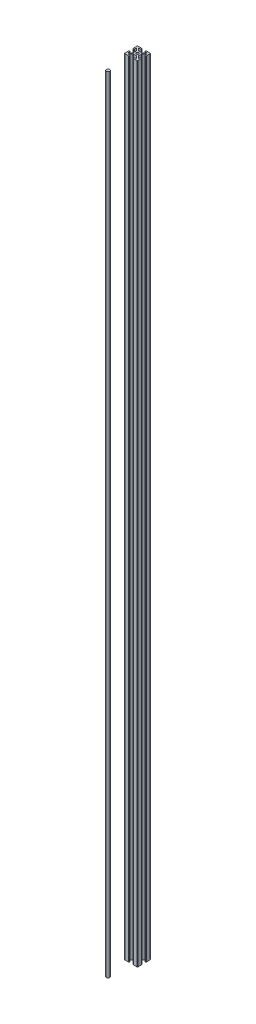
from build123d import *

# Parameters (mm, degrees)
ALUMINIUM_PROFILE_SIZES_4X4_1_OUTLINE_R = 2
ALUMINIUM_PROFILE_SIZES_4X4_1_DEPTH     = 1200
SKETCH12_R                              = 2.5
BOSS_EXTRUDE1_DEPTH                     = 1200
SKETCH13_R                              = 2.5
CUT_EXTRUDE1_DEPTH                      = 1202.021336197


# Read off the part's stored shape, not the designer's step: Aluminium profile sizes 4X4(1)
with BuildPart() as part:
    # Aluminium profile sizes 4X4(1) outline → Aluminium profile sizes 4X4(1) (new body)
    with BuildSketch(Plane(origin=(0, 0, 0), x_dir=(1, 0, 0), z_dir=(0, 1, 0))):
        with BuildLine():
            Line((4, -2.254415588), (4, 2.254415588))
            ThreePointArc((4, 2.254415588), (4.060896374, 2.560562334), (4.234314575, 2.820101013))
            Line((4.234314575, 2.820101013), (8, 6.585786438))
            Line((8, 6.585786438), (8, 3.8))
            ThreePointArc((8, 3.8), (8.234314575, 3.234314575), (8.8, 3))
            Line((8.8, 3), (9.2, 3))
            ThreePointArc((9.2, 3), (9.765685425, 3.234314575), (10, 3.8))
            Line((10, 3.8), (10, 9.2))
            ThreePointArc((10, 9.2), (9.765685425, 9.765685425), (9.2, 10))
            Line((9.2, 10), (3.8, 10))
            ThreePointArc((3.8, 10), (3.234314575, 9.765685425), (3, 9.2))
            Line((3, 9.2), (3, 8.8))
            ThreePointArc((3, 8.8), (3.234314575, 8.234314575), (3.8, 8))
            Line((3.8, 8), (6.585786438, 8))
            Line((6.585786438, 8), (2.820101013, 4.234314575))
            ThreePointArc((2.820101013, 4.234314575), (2.560562334, 4.060896374), (2.254415588, 4))
            Line((2.254415588, 4), (-2.254415588, 4))
            ThreePointArc((-2.254415588, 4), (-2.560562334, 4.060896374), (-2.820101013, 4.234314575))
            Line((-2.820101013, 4.234314575), (-6.585786438, 8))
            Line((-6.585786438, 8), (-3.8, 8))
            ThreePointArc((-3.8, 8), (-3.234314575, 8.234314575), (-3, 8.8))
            Line((-3, 8.8), (-3, 9.2))
            ThreePointArc((-3, 9.2), (-3.234314575, 9.765685425), (-3.8, 10))
            Line((-3.8, 10), (-9.2, 10))
            ThreePointArc((-9.2, 10), (-9.765685425, 9.765685425), (-10, 9.2))
            Line((-10, 9.2), (-10, 3.8))
            ThreePointArc((-10, 3.8), (-9.765685425, 3.234314575), (-9.2, 3))
            Line((-9.2, 3), (-8.8, 3))
            ThreePointArc((-8.8, 3), (-8.234314575, 3.234314575), (-8, 3.8))
            Line((-8, 3.8), (-8, 6.585786438))
            Line((-8, 6.585786438), (-4.234314575, 2.820101013))
            ThreePointArc((-4.234314575, 2.820101013), (-4.060896374, 2.560562334), (-4, 2.254415588))
            Line((-4, 2.254415588), (-4, -2.254415588))
            ThreePointArc((-4, -2.254415588), (-4.060896374, -2.560562334), (-4.234314575, -2.820101013))
            Line((-4.234314575, -2.820101013), (-8, -6.585786438))
            Line((-8, -6.585786438), (-8, -3.8))
            ThreePointArc((-8, -3.8), (-8.234314575, -3.234314575), (-8.8, -3))
            Line((-8.8, -3), (-9.2, -3))
            ThreePointArc((-9.2, -3), (-9.765685425, -3.234314575), (-10, -3.8))
            Line((-10, -3.8), (-10, -9.2))
            ThreePointArc((-10, -9.2), (-9.765685425, -9.765685425), (-9.2, -10))
            Line((-9.2, -10), (-3.8, -10))
            ThreePointArc((-3.8, -10), (-3.234314575, -9.765685425), (-3, -9.2))
            Line((-3, -9.2), (-3, -8.8))
            ThreePointArc((-3, -8.8), (-3.234314575, -8.234314575), (-3.8, -8))
            Line((-3.8, -8), (-6.585786438, -8))
            Line((-6.585786438, -8), (-2.820101013, -4.234314575))
            ThreePointArc((-2.820101013, -4.234314575), (-2.560562334, -4.060896374), (-2.254415588, -4))
            Line((-2.254415588, -4), (2.254415588, -4))
            ThreePointArc((2.254415588, -4), (2.560562334, -4.060896374), (2.820101013, -4.234314575))
            Line((2.820101013, -4.234314575), (6.585786438, -8))
            Line((6.585786438, -8), (3.8, -8))
            ThreePointArc((3.8, -8), (3.234314575, -8.234314575), (3, -8.8))
            Line((3, -8.8), (3, -9.2))
            ThreePointArc((3, -9.2), (3.234314575, -9.765685425), (3.8, -10))
            Line((3.8, -10), (9.2, -10))
            ThreePointArc((9.2, -10), (9.765685425, -9.765685425), (10, -9.2))
            Line((10, -9.2), (10, -3.8))
            ThreePointArc((10, -3.8), (9.765685425, -3.234314575), (9.2, -3))
            Line((9.2, -3), (8.8, -3))
            ThreePointArc((8.8, -3), (8.234314575, -3.234314575), (8, -3.8))
            Line((8, -3.8), (8, -6.585786438))
            Line((8, -6.585786438), (4.234314575, -2.820101013))
            ThreePointArc((4.234314575, -2.820101013), (4.060896374, -2.560562334), (4, -2.254415588))
        make_face()
        Circle(ALUMINIUM_PROFILE_SIZES_4X4_1_OUTLINE_R, mode=Mode.SUBTRACT)
    extrude(amount=ALUMINIUM_PROFILE_SIZES_4X4_1_DEPTH)

    # Sketch13 → Cut-Extrude1 (cut, through all)
    with BuildSketch(Plane.ZY.offset(4)):
        with Locations(Location((0, 800, 0), (0, 0, 25.608789007))):
            Circle(SKETCH13_R)
    extrude(amount=-CUT_EXTRUDE1_DEPTH, mode=Mode.SUBTRACT)


with BuildPart() as body_2:
    # Sketch12 → Boss-Extrude1 (new body)
    with BuildSketch(Plane(origin=(0, 1200, 0), x_dir=(1, 0, 0), z_dir=(0, 1, 0))):
        with Locations(Location((0, -45, 0), (0, 0, 270))):
            Circle(SKETCH12_R)
    extrude(amount=-BOSS_EXTRUDE1_DEPTH)


solid = Compound([part.part, body_2.part])
